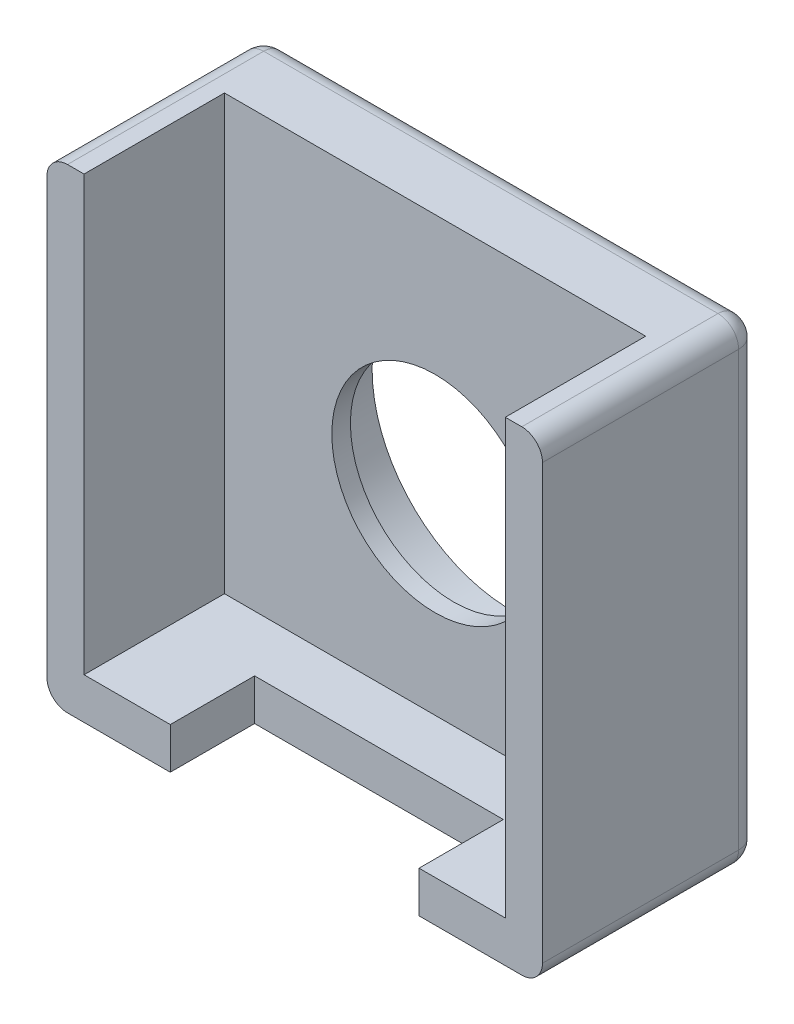
from build123d import *

# Parameters (mm, degrees)
EXTRUDE_1_DEPTH          = 24
SKETCH_2_W               = 20.4
SKETCH_2_H               = 6.8
CUT_EXTRUDE_1_DEPTH      = 21
CUT_EXTRUDE_2_REACH      = 36.86
SKETCH_3_W               = 12.046070068
SKETCH_3_H               = 8.16612352
FILLET_1_R               = 1
SKETCH_3D_3_R            = 6.75
CUT_EXTRUDE_3_DEPTH      = 2.8
CUT_EXTRUDE_4_DEPTH      = 19.32075326
CUT_EXTRUDE_4_DEPTH_BACK = 19.32075326
SKETCH_3D_4_R            = 5


with BuildPart() as part:
    # Sketch 3D_1 → 凸台-拉伸1 (new body)
    with BuildSketch(Plane(origin=(0, 0, 0), x_dir=(0, 0.909688003863034, -0.41529234958964595), z_dir=(1, 0, 0))):
        Polygon((0, 0), (20.922824089, 9.551724041), (25.28339376, 0), (4.360569671, -9.551724041), align=None)
    extrude(amount=EXTRUDE_1_DEPTH)

    # 草图2 → 切除-拉伸1 (cut)
    with BuildSketch(Plane(origin=(0, 23, 0), x_dir=(1, 0, 0), z_dir=(0, 1, 0))):
        with Locations((12, 3.4)):
            Rectangle(SKETCH_2_W, SKETCH_2_H)
    extrude(amount=-CUT_EXTRUDE_1_DEPTH, mode=Mode.SUBTRACT)

    # 草图3 → 切除-拉伸2 (cut, up to next)
    with BuildSketch(Plane.XZ, mode=Mode.PRIVATE) as cut_extrude_2_sk1:
        with Locations((12, 0)):
            Rectangle(SKETCH_3_W, SKETCH_3_H)
    cut_extrude_2_tool1 = extrude(cut_extrude_2_sk1.sketch, amount=-CUT_EXTRUDE_2_REACH, mode=Mode.PRIVATE) & part.part
    add(cut_extrude_2_tool1.solids().sort_by_distance((12, 0, 0))[0], mode=Mode.SUBTRACT)

    # 圆角1
    fillet_1_edges = [part.edges().sort_by_distance(p)[0] for p in [
        (24, 23, -5.25),
        (24, 0, -5.25),
        (24, 11.5, -10.5),
        (12, 0, -10.5),
        (0, 0, -5.25),
        (0, 11.5, -10.5),
        (12, 23, -10.5),
        (0, 23, -5.25),
    ]]
    fillet(fillet_1_edges, radius=FILLET_1_R)

    # Sketch 3D_3 → 切除-拉伸3 (cut)
    with BuildSketch(Plane(origin=(12, 11.3, -10.5), x_dir=(0, 1, 0), z_dir=(0, 0, -1))):
        Circle(SKETCH_3D_3_R)
    extrude(amount=-CUT_EXTRUDE_3_DEPTH, mode=Mode.SUBTRACT)

    # Sketch 3D_4 → 切除-拉伸4 (cut, two sides: drawn at the far end of the back side and taken through both)
    with BuildSketch(Plane(origin=(12, 11.3, -7.4), x_dir=(0, 1, 0), z_dir=(0, 0, -1)).offset(-CUT_EXTRUDE_4_DEPTH_BACK)):
        Circle(SKETCH_3D_4_R)
    extrude(amount=CUT_EXTRUDE_4_DEPTH + CUT_EXTRUDE_4_DEPTH_BACK, mode=Mode.SUBTRACT)


solid = part.part
